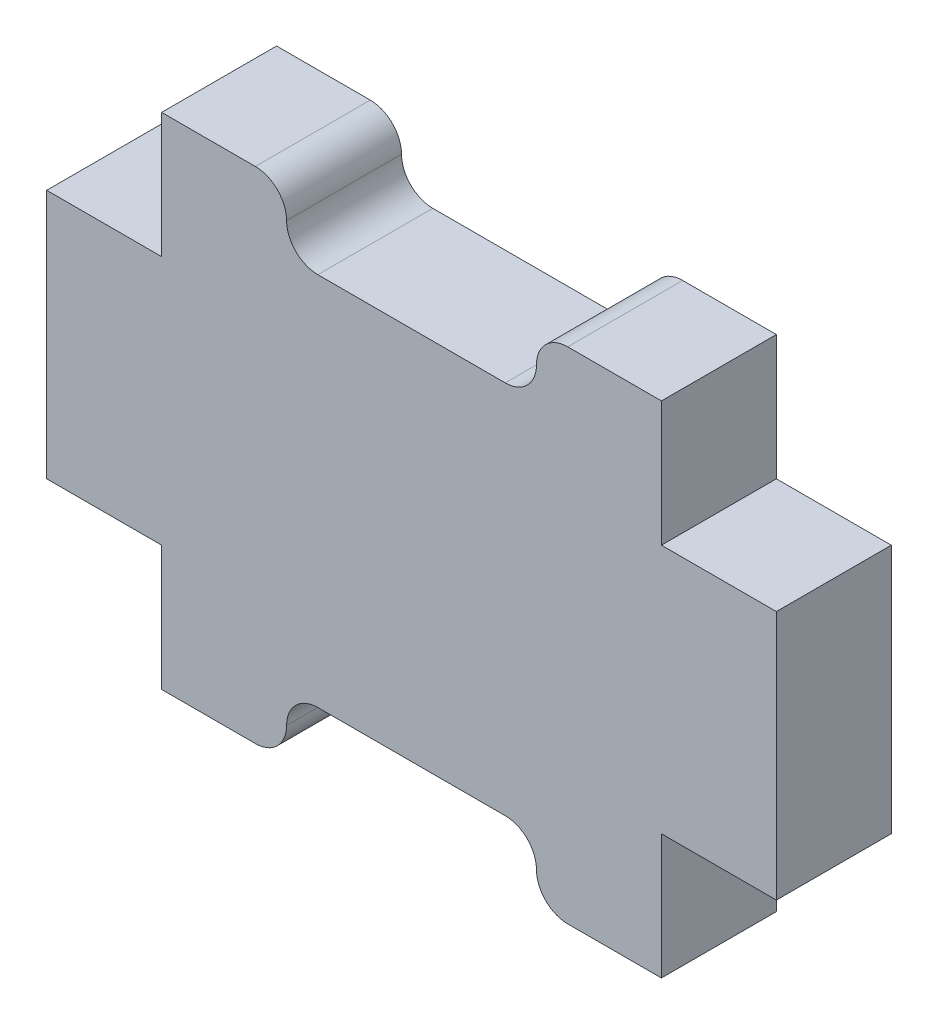
from build123d import *

# Parameters (mm, degrees)
BOSS_EXTRUDE1_DEPTH = 5.842
SKETCH2_W           = 12.7
SKETCH2_H           = 3.175
CUT_EXTRUDE1_DEPTH  = 41.686011454
FILLET1_START       = -1
FILLET1_DEPTH       = 8
FILLET1_2_DEPTH     = 5.842


with BuildPart() as part:
    # Sketch1 → Boss-Extrude1 (new body)
    with BuildSketch(Plane.XY):
        Polygon((0, 0), (-25.4, 0), (-25.4, 6.35), (-31.242, 6.35), (-31.242, 19.05), (-25.4, 19.05), (-25.4, 25.4), (0, 25.4), (0, 19.05), (5.842, 19.05), (5.842, 6.35), (0, 6.35), align=None)
    extrude(amount=BOSS_EXTRUDE1_DEPTH)

    # Sketch2 → Cut-Extrude1 (cut, through all)
    with BuildSketch(Plane.XY.offset(5.842)):
        with Locations((-12.7, 23.8125)):
            Rectangle(SKETCH2_W, SKETCH2_H)
        with Locations((-12.7, 1.5875)):
            Rectangle(SKETCH2_W, SKETCH2_H)
    extrude(amount=-CUT_EXTRUDE1_DEPTH, mode=Mode.SUBTRACT)

    # Fillet1: read off the stored shape, not the designer's step
    # Fillet1 outline → Fillet1 (cut)
    with BuildSketch(Plane.XY.offset(FILLET1_START)):
        with BuildLine():
            ThreePointArc((-20.6375, 25.4), (-19.514967985, 24.935032015), (-19.05, 23.8125))
            Line((-19.05, 23.8125), (-19.05, 25.4))
            Line((-19.05, 25.4), (-20.6375, 25.4))
        make_face()
        with BuildLine():
            Line((-6.35, 25.4), (-6.35, 23.8125))
            ThreePointArc((-6.35, 23.8125), (-5.885032015, 24.935032015), (-4.7625, 25.4))
            Line((-4.7625, 25.4), (-6.35, 25.4))
        make_face()
        with BuildLine():
            ThreePointArc((-4.7625, 0), (-5.885032015, 0.464967985), (-6.35, 1.5875))
            Line((-6.35, 1.5875), (-6.35, 0))
            Line((-6.35, 0), (-4.7625, 0))
        make_face()
        with BuildLine():
            Line((-19.05, 0), (-19.05, 1.5875))
            ThreePointArc((-19.05, 1.5875), (-19.514967985, 0.464967985), (-20.6375, 0))
            Line((-20.6375, 0), (-19.05, 0))
        make_face()
    extrude(amount=FILLET1_DEPTH, mode=Mode.SUBTRACT)

    # Fillet1 2 outline → Fillet1 2 (add)
    with BuildSketch(Plane.XY):
        with BuildLine():
            Line((-19.05, 22.225), (-17.4625, 22.225))
            ThreePointArc((-17.4625, 22.225), (-18.585032015, 22.689967985), (-19.05, 23.8125))
            Line((-19.05, 23.8125), (-19.05, 22.225))
        make_face()
        with BuildLine():
            ThreePointArc((-6.35, 23.8125), (-6.814967985, 22.689967985), (-7.9375, 22.225))
            Line((-7.9375, 22.225), (-6.35, 22.225))
            Line((-6.35, 22.225), (-6.35, 23.8125))
        make_face()
        with BuildLine():
            Line((-6.35, 3.175), (-7.9375, 3.175))
            ThreePointArc((-7.9375, 3.175), (-6.814967985, 2.710032015), (-6.35, 1.5875))
            Line((-6.35, 1.5875), (-6.35, 3.175))
        make_face()
        with BuildLine():
            ThreePointArc((-19.05, 1.5875), (-18.585032015, 2.710032015), (-17.4625, 3.175))
            Line((-17.4625, 3.175), (-19.05, 3.175))
            Line((-19.05, 3.175), (-19.05, 1.5875))
        make_face()
    extrude(amount=FILLET1_2_DEPTH)


solid = part.part
